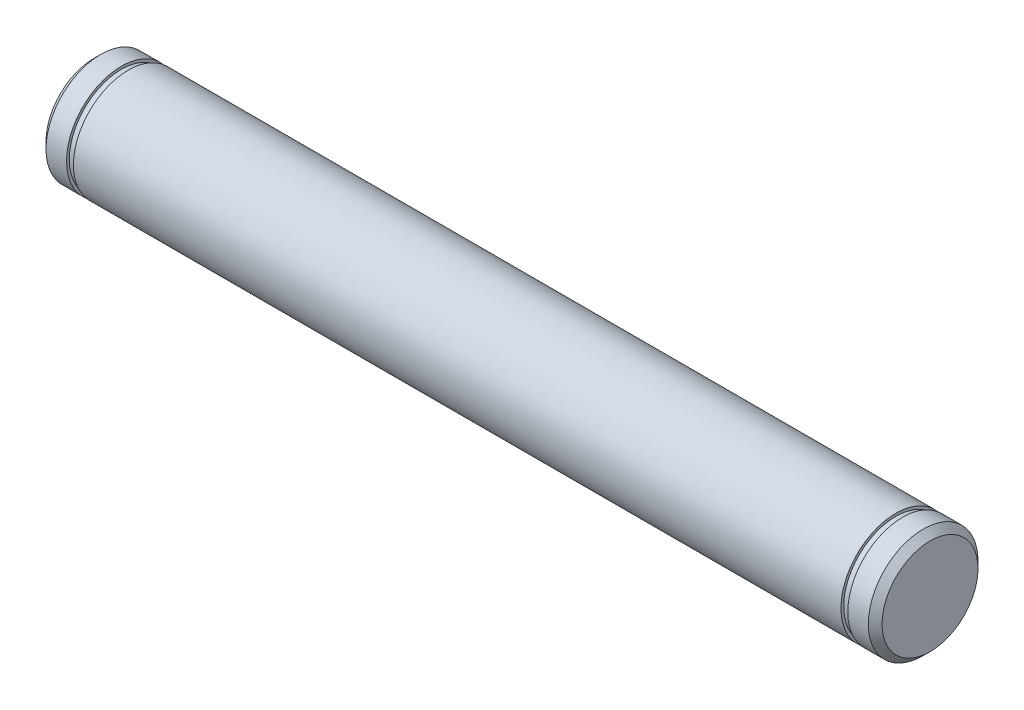
from build123d import *

# Parameters (mm, degrees)
SKETCH1_R           = 2
BOSS_EXTRUDE1_DEPTH = 30.5
CUT_EXTRUDE2_START  = -1
SKETCH2_R           = 2.498108329
SKETCH2_R_2         = 1.9
CUT_EXTRUDE2_DEPTH  = 0.25
CUT_EXTRUDE3_START  = -1.25
SKETCH3_R           = 2.5
SKETCH3_R_2         = 1.9
CUT_EXTRUDE3_DEPTH  = 0.25
CHAMFER1_SIZE       = 0.25


with BuildPart() as part:
    # Sketch1 → Boss-Extrude1 (new body)
    with BuildSketch(Plane(origin=(0, 0, 0), x_dir=(0, 0, -1), z_dir=(1, 0, 0))):
        Circle(SKETCH1_R)
    extrude(amount=BOSS_EXTRUDE1_DEPTH)

    # Sketch2 → Cut-Extrude2 (cut)
    with BuildSketch(Plane(origin=(30.5, 0, 0), x_dir=(0, 0, -1), z_dir=(1, 0, 0)).offset(CUT_EXTRUDE2_START)):
        Circle(SKETCH2_R)
        Circle(SKETCH2_R_2, mode=Mode.SUBTRACT)
    extrude(amount=-CUT_EXTRUDE2_DEPTH, mode=Mode.SUBTRACT)

    # Sketch3 → Cut-Extrude3 (cut)
    with BuildSketch(Plane.ZY.offset(CUT_EXTRUDE3_START)):
        Circle(SKETCH3_R)
        Circle(SKETCH3_R_2, mode=Mode.SUBTRACT)
    extrude(amount=CUT_EXTRUDE3_DEPTH, mode=Mode.SUBTRACT)

    # Chamfer1
    chamfer1_edges = [part.edges().sort_by_distance(p)[0] for p in [
        (0, 0, 2),
        (30.5, 0, 2),
    ]]
    chamfer(chamfer1_edges, length=CHAMFER1_SIZE)


solid = part.part
